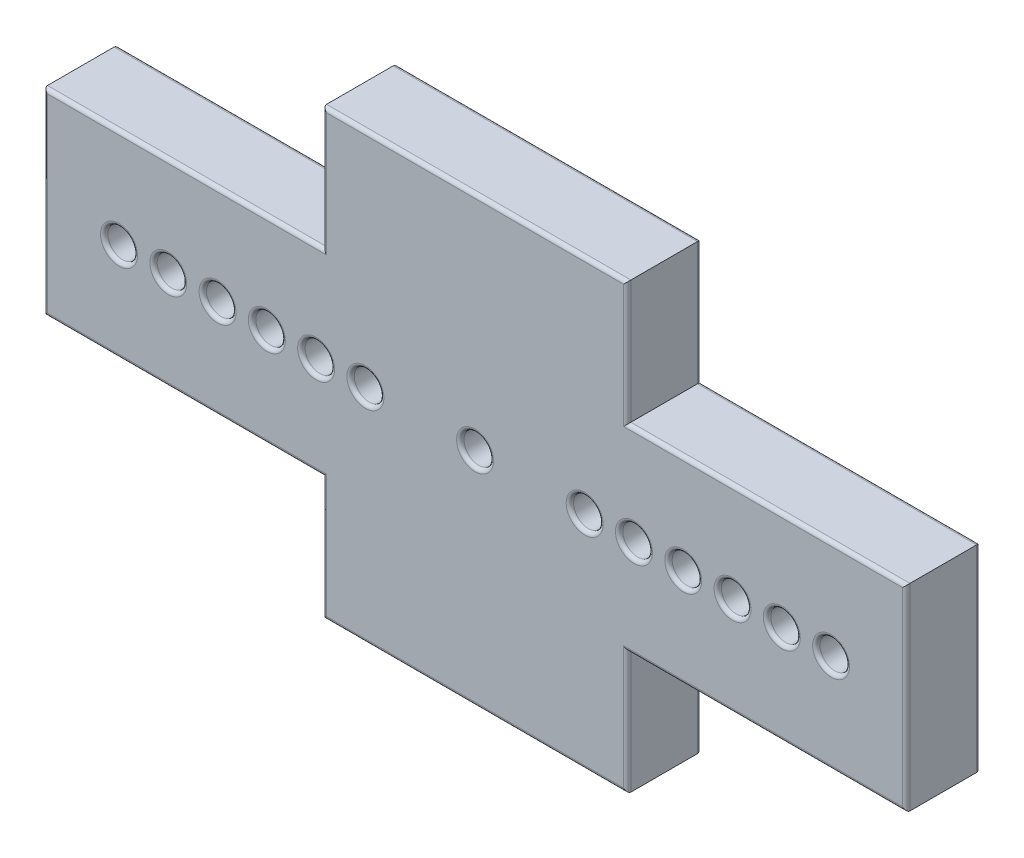
from build123d import *

# Parameters (mm, degrees)
DODANIE_WYCI_GNI_CIE1_DEPTH = 1.5
SZKIC2_R                    = 0.6
WYTNIJ_WYCI_GNI_CIE1_DEPTH  = 20.906029237
SZKIC3_R                    = 0.6
WYTNIJ_WYCI_GNI_CIE2_DEPTH  = 20.906029237
ZAOKR_GLENIE1_R             = 0.15


with BuildPart() as part:
    # Szkic1 → Dodanie-wyciągnięcie1 (new, symmetric)
    with BuildSketch(Plane.XY):
        Polygon((-17.5, -4), (-17.5, 4), (-6.175, 4), (-6.175, 9), (6.175, 9), (6.175, 4), (17.5, 4), (17.5, -4), (6.175, -4), (6.175, -9), (-6.175, -9), (-6.175, -4), align=None)
    extrude(amount=DODANIE_WYCI_GNI_CIE1_DEPTH, both=True)

    # Szkic2 → Wytnij-wyciągnięcie1 (cut, through all)
    with BuildSketch(Plane.XY.offset(1.5)):
        Circle(SZKIC2_R)
    extrude(amount=-WYTNIJ_WYCI_GNI_CIE1_DEPTH, mode=Mode.SUBTRACT)

    # Szkic3 → Wytnij-wyciągnięcie2 (cut, through all)
    with BuildSketch(Plane.XY.offset(1.5)):
        with Locations((-4.45, 0)):
            Circle(SZKIC3_R)
        with Locations((-6.45, 0)):
            Circle(SZKIC3_R)
        with Locations((-8.45, 0)):
            Circle(SZKIC3_R)
        with Locations((-10.45, 0)):
            Circle(SZKIC3_R)
        with Locations((-12.45, 0)):
            Circle(SZKIC3_R)
        with Locations((-14.45, 0)):
            Circle(SZKIC3_R)
    wytnij_wyci_gni_cie2 = extrude(amount=-WYTNIJ_WYCI_GNI_CIE2_DEPTH, mode=Mode.SUBTRACT)

    # Lustro1: Wytnij-wyciągnięcie2 across plane
    add(wytnij_wyci_gni_cie2.mirror(Plane(origin=(0, 0, 0), x_dir=(0, 0, 1), z_dir=(1, 0, 0))), mode=Mode.SUBTRACT)

    # Zaokrąglenie1
    zaokr_glenie1_edges = [part.edges().sort_by_distance(p)[0] for p in [
        (0, 9, -1.5),
        (-6.175, 6.5, -1.5),
        (-11.8375, 4, -1.5),
        (-17.5, 0, -1.5),
        (-11.8375, -4, -1.5),
        (-6.175, -6.5, -1.5),
        (0, -9, -1.5),
        (6.175, -6.5, -1.5),
        (11.8375, -4, -1.5),
        (17.5, 0, -1.5),
        (11.8375, 4, -1.5),
        (6.175, 6.5, -1.5),
        (-0.6, 0, -1.5),
        (-15.05, 0, -1.5),
        (-13.05, 0, -1.5),
        (-11.05, 0, -1.5),
        (-9.05, 0, -1.5),
        (-7.05, 0, -1.5),
        (-5.05, 0, -1.5),
        (15.05, 0, -1.5),
        (13.05, 0, -1.5),
        (11.05, 0, -1.5),
        (9.05, 0, -1.5),
        (7.05, 0, -1.5),
        (5.05, 0, -1.5),
        (11.8375, 4, 1.5),
        (17.5, 0, 1.5),
        (11.8375, -4, 1.5),
        (6.175, -6.5, 1.5),
        (0, -9, 1.5),
        (-6.175, -6.5, 1.5),
        (-11.8375, -4, 1.5),
        (-17.5, 0, 1.5),
        (-11.8375, 4, 1.5),
        (-6.175, 6.5, 1.5),
        (0, 9, 1.5),
        (6.175, 6.5, 1.5),
        (-0.6, 0, 1.5),
        (-15.05, 0, 1.5),
        (-13.05, 0, 1.5),
        (-11.05, 0, 1.5),
        (-9.05, 0, 1.5),
        (-7.05, 0, 1.5),
        (-5.05, 0, 1.5),
        (15.05, 0, 1.5),
        (13.05, 0, 1.5),
        (11.05, 0, 1.5),
        (9.05, 0, 1.5),
        (7.05, 0, 1.5),
        (5.05, 0, 1.5),
    ]]
    fillet(zaokr_glenie1_edges, radius=ZAOKR_GLENIE1_R)


solid = part.part
